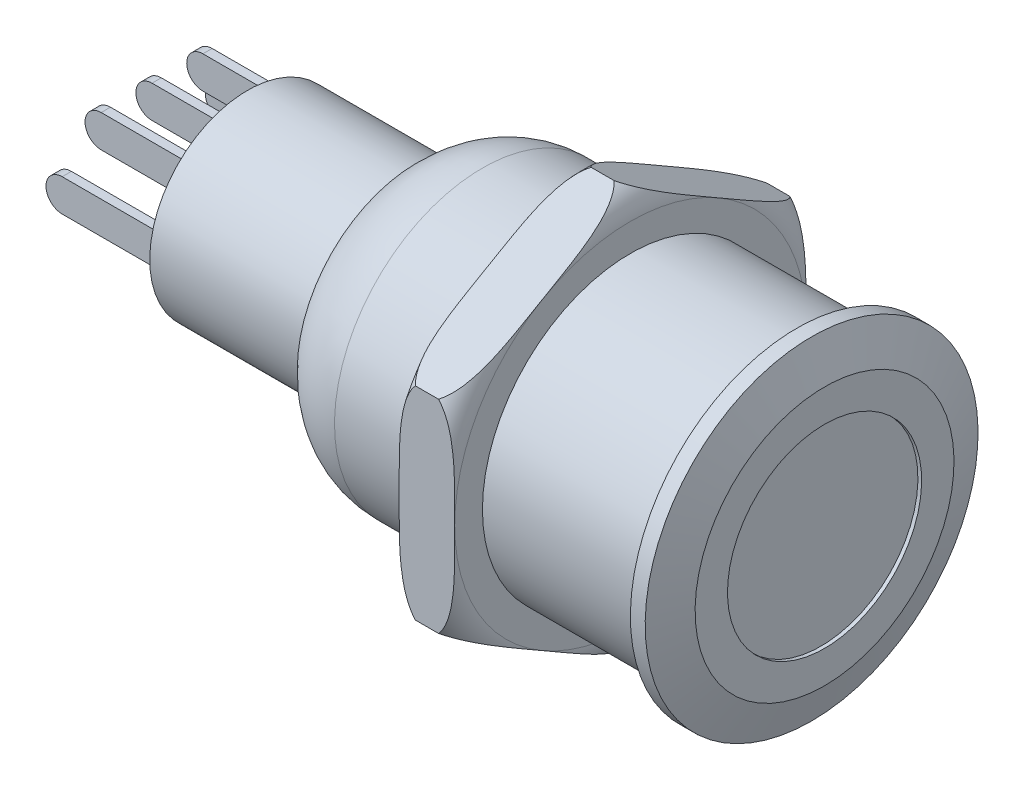
from build123d import *
from OCP.BRepAlgoAPI import BRepAlgoAPI_Cut
from OCP.TopTools import TopTools_ListOfShape

# Parameters (mm, degrees)
SKETCH2_R           = 5.25
CUT_EXTRUDE1_DEPTH  = 0.2
SKETCH3_W           = 0.5
SKETCH3_H           = 1.75
BOSS_EXTRUDE1_DEPTH = 5.79
SKETCH4_W           = 0.5
SKETCH4_H           = 1.75
BOSS_EXTRUDE2_DEPTH = 6.34
CUT_EXTRUDE2_DEPTH  = 41.425877851
CUT_EXTRUDE3_DEPTH  = 41.916075081
BOSS_EXTRUDE3_DEPTH = 3


with BuildPart() as part:
    # Sketch1 → Revolve1 (revolve)
    with BuildSketch(Plane.XY):
        with BuildLine():
            Line((0, 0), (0, 7))
            Line((0, 7), (-0.7, 9))
            Line((-0.7, 9), (-1.5, 9))
            Line((-1.5, 9), (-1.5, 8))
            Line((-1.5, 8), (-18.5, 8))
            ThreePointArc((-18.5, 8), (-20.454565169, 7.590250513), (-22.08, 6.43))
            Line((-22.08, 6.43), (-22.08, 5.29))
            Line((-22.08, 5.29), (-31.2, 5.29))
            Line((-31.2, 5.29), (-31.2, 0))
            Line((-31.2, 0), (0, 0))
        make_face()
    revolve(axis=Axis((-31.2, 0, 0), (1, 0, 0)))

    # Sketch2 → Cut-Extrude1 (cut)
    with BuildSketch(Plane(origin=(0, 0, 0), x_dir=(0, 0, -1), z_dir=(1, 0, 0))):
        Circle(SKETCH2_R)
    extrude(amount=-CUT_EXTRUDE1_DEPTH, mode=Mode.SUBTRACT)

    # Sketch3 → Boss-Extrude1 (add)
    with BuildSketch(Plane.ZY.offset(31.2)):
        with Locations((-4.31, -0.085)):
            Rectangle(SKETCH3_W, SKETCH3_H)
        with Locations((-2.75, 2.415)):
            Rectangle(SKETCH3_W, SKETCH3_H)
        with Locations((0, 2.415)):
            Rectangle(SKETCH3_W, SKETCH3_H)
        with Locations((2.75, 2.415)):
            Rectangle(SKETCH3_W, SKETCH3_H)
        with Locations((4.31, -0.085)):
            Rectangle(SKETCH3_W, SKETCH3_H)
    extrude(amount=BOSS_EXTRUDE1_DEPTH)

    # Sketch4 → Boss-Extrude2 (add)
    with BuildSketch(Plane.ZY.offset(31.2)):
        with Locations((4.31, -0.085)):
            Rectangle(SKETCH4_W, SKETCH4_H)
        with Locations((-4.31, -0.085)):
            Rectangle(SKETCH4_W, SKETCH4_H)
    extrude(amount=BOSS_EXTRUDE2_DEPTH)

    # Sketch5 → Cut-Extrude2 (cut, through all)
    with BuildSketch(Plane(origin=(0, 0, -3), x_dir=(-1, 0, 0), z_dir=(0, 0, -1))):
        with BuildLine():
            Line((36.99, 1.54), (36.99, 2.415))
            ThreePointArc((36.99, 2.415), (36.733718434, 1.796281566), (36.115, 1.54))
            Line((36.115, 1.54), (36.99, 1.54))
        make_face()
        with BuildLine():
            Line((36.99, 2.415), (36.99, 3.29))
            Line((36.99, 3.29), (36.115, 3.29))
            ThreePointArc((36.115, 3.29), (36.733718434, 3.033718434), (36.99, 2.415))
        make_face()
    extrude(amount=-CUT_EXTRUDE2_DEPTH, mode=Mode.SUBTRACT)

    # Sketch6 → Cut-Extrude3 (cut, through all)
    with BuildSketch(Plane(origin=(0, 0, -4.56), x_dir=(-1, 0, 0), z_dir=(0, 0, -1))):
        with BuildLine():
            Line((37.54, 0.79), (36.665, 0.79))
            ThreePointArc((36.665, 0.79), (37.283718434, 0.533718434), (37.54, -0.085))
            Line((37.54, -0.085), (37.54, 0.79))
        make_face()
        with BuildLine():
            ThreePointArc((37.54, -0.085), (37.283718434, -0.703718434), (36.665, -0.96))
            Line((36.665, -0.96), (37.54, -0.96))
            Line((37.54, -0.96), (37.54, -0.085))
        make_face()
    extrude(amount=-CUT_EXTRUDE3_DEPTH, mode=Mode.SUBTRACT)

    # Sketch7 → Boss-Extrude3 (add)
    with BuildSketch(Plane.ZY.offset(13.5)):
        Polygon((0, 10.969655115), (-9.5, 5.484827557), (-9.5, -5.484827557), (0, -10.969655115), (9.5, -5.484827557), (9.5, 5.484827557), align=None)
    extrude(amount=-BOSS_EXTRUDE3_DEPTH)


with BuildPart() as cut_revolve3_tool:
    # Sketch8 → Cut-Revolve3 (revolve)
    with BuildSketch(Plane.XY):
        with BuildLine():
            Line((-12.625, 10.969655115), (-11.375, 10.969655115))
            ThreePointArc((-11.375, 10.969655115), (-10.735311186, 10.355206284), (-10.5, 9.5))
            Line((-10.5, 9.5), (-10.5, 15))
            Line((-10.5, 15), (-13.5, 15))
            Line((-13.5, 15), (-13.5, 9.5))
            ThreePointArc((-13.5, 9.5), (-13.264688814, 10.355206284), (-12.625, 10.969655115))
        make_face()
    revolve(axis=Axis((0, 0, 0), (-1, 0, 0)))


with BuildPart() as part_1:
    add(part.part)

    # Cut-Revolve3: cut by cut_revolve3_tool, with a tolerance
    cut_revolve3_stock = TopTools_ListOfShape()
    cut_revolve3_stock.Append(part_1.part.wrapped)
    cut_revolve3_tools = TopTools_ListOfShape()
    cut_revolve3_tools.Append(cut_revolve3_tool.part.wrapped)
    cut_revolve3_cut = BRepAlgoAPI_Cut()
    cut_revolve3_cut.SetArguments(cut_revolve3_stock)
    cut_revolve3_cut.SetTools(cut_revolve3_tools)
    cut_revolve3_cut.SetFuzzyValue(0.00001)
    cut_revolve3_cut.Build()
    add(Compound.cast(cut_revolve3_cut.Shape()).solids(), mode=Mode.REPLACE)


solid = part_1.part
